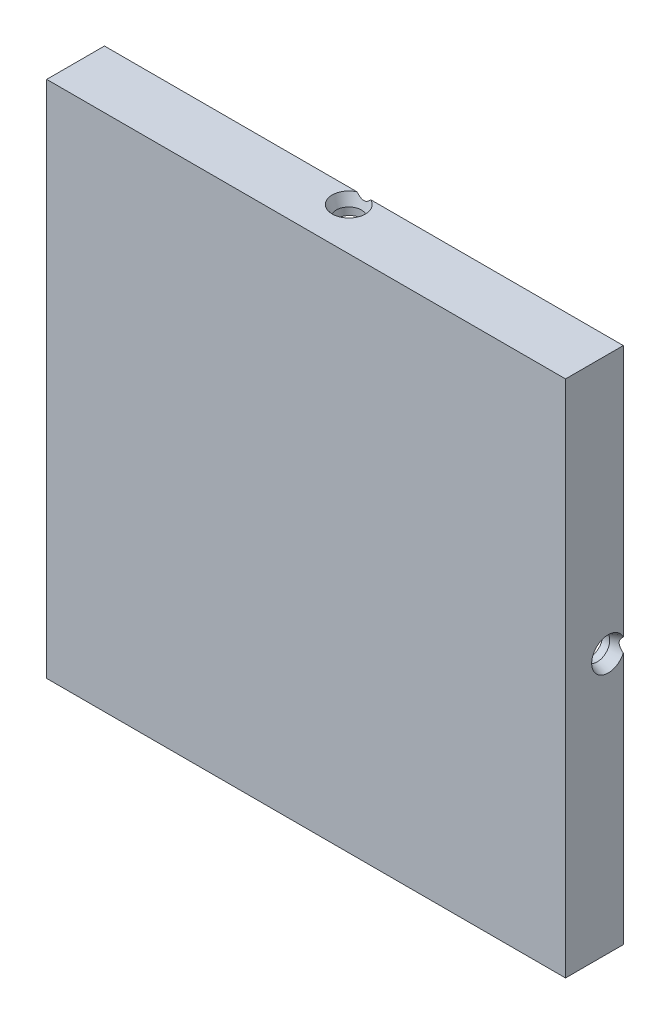
from build123d import *

# Parameters (mm, degrees)
SKETCH1_W               = 163.957
SKETCH1_H               = 163.957
SKETCH1_R               = 3.048
BOSS_EXTRUDE1_DEPTH     = 8.73125
BOSS_EXTRUDE2_START     = -9.525
SKETCH1_3_W             = 163.957
SKETCH1_3_H             = 163.957
SKETCH1_3_R             = 3.33375
SKETCH1_3_R_2           = 76.2
SKETCH1_3_R_3           = 3.01625
SKETCH1_3_R_4           = 3.048
BOSS_EXTRUDE2_DEPTH     = 9.525
SKETCH1_4_R             = 3.01625
BOSS_EXTRUDE3_DEPTH     = 18.3515
CUT_EXTRUDE1_REACH      = 186.226
CUT_EXTRUDE1_END_RADIUS = 76.2
SKETCH2_R               = 3.96875
CIRPATTERN1_COUNT       = 4
SKETCH5_R               = 3.047999999
BOSS_EXTRUDE4_DEPTH     = 9.525
CHAMFER1_SIZE           = 1.27
CHAMFER1_SIZE_2         = 3.489296323
BOSS_EXTRUDE5_DEPTH     = 18.25625
FILLET4_R               = 2.54


with BuildPart() as part:
    # Sketch1 → Boss-Extrude1 (new body)
    with BuildSketch(Plane.XY):
        Rectangle(SKETCH1_W, SKETCH1_H)
        with Locations((-26.851716639, -9.773225596)):
            Circle(SKETCH1_R, mode=Mode.SUBTRACT)
    extrude(amount=BOSS_EXTRUDE1_DEPTH)

    # Sketch1<3> → Boss-Extrude2 (add)
    # profile 1 of 6: a face of its own
    with BuildSketch(Plane.XY.offset(BOSS_EXTRUDE2_START)):
        Rectangle(SKETCH1_3_W, SKETCH1_3_H)
        with Locations((-69.2785, -69.2785)):
            Circle(SKETCH1_3_R, mode=Mode.SUBTRACT)
        with Locations((69.2785, -69.2785)):
            Circle(SKETCH1_3_R, mode=Mode.SUBTRACT)
        with Locations((69.2785, 69.2785)):
            Circle(SKETCH1_3_R, mode=Mode.SUBTRACT)
        with Locations((-69.2785, 69.2785)):
            Circle(SKETCH1_3_R, mode=Mode.SUBTRACT)
        Circle(SKETCH1_3_R_2, mode=Mode.SUBTRACT)
    # profile 2 of 6: a face of its own
    with BuildSketch(Plane.XY.offset(BOSS_EXTRUDE2_START)):
        with Locations((53.703433278, 19.546451191)):
            Circle(SKETCH1_3_R_3)
    # profile 3 of 6: a face of its own
    with BuildSketch(Plane.XY.offset(BOSS_EXTRUDE2_START)):
        with Locations((-9.923993354, -56.281763085)):
            Circle(SKETCH1_3_R_3)
    # profile 4 of 6: a face of its own
    with BuildSketch(Plane.XY.offset(BOSS_EXTRUDE2_START)):
        Circle(SKETCH1_3_R_3)
    # profile 5 of 6: a face of its own
    with BuildSketch(Plane.XY.offset(BOSS_EXTRUDE2_START)):
        with Locations((-43.779439924, 36.735311894)):
            Circle(SKETCH1_3_R_3)
    # profile 6 of 6: a face of its own
    with BuildSketch(Plane.XY.offset(BOSS_EXTRUDE2_START)):
        with Locations((-26.851716639, -9.773225596)):
            Circle(SKETCH1_3_R_4)
    extrude(amount=BOSS_EXTRUDE2_DEPTH)


with BuildPart() as boss_extrude2_piece_1:
    # of the separate pieces the step leaves, piece 1, a body of its own (boss_extrude2_pieces)
    add(part.part.solids().sort_by_distance((-81.9785, 81.9785, 8.73125))[0])

    # Sketch1<4> → Boss-Extrude3 (add)
    with BuildSketch(Plane.XY):
        Circle(SKETCH1_4_R)
    extrude(amount=-BOSS_EXTRUDE3_DEPTH)

    # Cut-Extrude1: up to this cylinder (the profile starts outside it)
    cut_extrude1_end = Plane(origin=(0, 0, -4.7625), z_dir=(0, 0, 1)) * Cylinder(CUT_EXTRUDE1_END_RADIUS, 525.852, mode=Mode.PRIVATE)
    # Sketch2 → Cut-Extrude1 (cut, up to the surface)
    with BuildSketch(Plane(origin=(0, 81.9785, 0), x_dir=(1, 0, 0), z_dir=(0, 1, 0)), mode=Mode.PRIVATE) as cut_extrude1_sk1:
        with Locations(Location((0, 4.7625, 0), (0, 0, 270))):
            Circle(SKETCH2_R)
    cut_extrude1_tool1 = extrude(cut_extrude1_sk1.sketch, amount=-CUT_EXTRUDE1_REACH, mode=Mode.PRIVATE) - cut_extrude1_end
    cut_extrude1 = cut_extrude1_tool1.solids().sort_by_distance((0, 81.9785, -4.7625))[0]
    add(cut_extrude1, mode=Mode.SUBTRACT)

    # CirPattern1: Cut-Extrude1 ×4 about axis
    cirpattern1_axis = Axis((0, 0, -9.525), (0, 0, 1))
    for i in range(1, CIRPATTERN1_COUNT):
        add(cut_extrude1.rotate(cirpattern1_axis, i * 360 / CIRPATTERN1_COUNT), mode=Mode.SUBTRACT)



with BuildPart() as boss_extrude2_piece_2:
    # of the separate pieces the step leaves, piece 2, a body of its own (boss_extrude2_pieces)
    add(part.part.solids().sort_by_distance((-23.803716639, -9.773225596, -9.525))[0])


with BuildPart() as boss_extrude2_piece_1_1:
    add(boss_extrude2_piece_1.part)

    add(boss_extrude2_piece_2.part)  # Boss-Extrude4 merges Boss-Extrude2 piece 2
    # Sketch5 → Boss-Extrude4 (add)
    with BuildSketch(Plane.XY.offset(8.73125)):
        with Locations((-26.851716639, -9.773225596)):
            Circle(SKETCH5_R)
    extrude(amount=-BOSS_EXTRUDE4_DEPTH)

    # Chamfer1
    # the kernel refuses this chamfer: 3.489296323, 1.27 mm, written as the material it takes off along each edge
    with BuildSketch(Plane(origin=(0, 81.9785, -4.7625), x_dir=(0, 0, 1), z_dir=(-1, 0, 0))) as chamfer1_piece_1:
        Polygon((3.96875 + CHAMFER1_SIZE, 0), (3.96875, -CHAMFER1_SIZE_2), (3.96875, 0), align=None)
    revolve(axis=Axis((0, 81.9785, -4.7625), (0, 1, 0)), mode=Mode.SUBTRACT)
    with BuildSketch(Plane(origin=(-81.9785, 0, -4.7625), x_dir=(0, 0, 1), z_dir=(0, -1, 0))) as chamfer1_piece_2:
        Polygon((3.96875 + CHAMFER1_SIZE, 0), (3.96875, -CHAMFER1_SIZE_2), (3.96875, 0), align=None)
    revolve(axis=Axis((-81.9785, 0, -4.7625), (-1, 0, 0)), mode=Mode.SUBTRACT)
    with BuildSketch(Plane(origin=(0, -81.9785, -4.7625), x_dir=(0, 0, 1), z_dir=(1, 0, 0))) as chamfer1_piece_3:
        Polygon((3.96875, -CHAMFER1_SIZE_2), (3.96875 + CHAMFER1_SIZE, 0), (3.96875, 0), align=None)
    revolve(axis=Axis((0, -81.9785, -4.7625), (0, -1, 0)), mode=Mode.SUBTRACT)
    with BuildSketch(Plane(origin=(81.9785, 0, -4.7625), x_dir=(0, 0, 1), z_dir=(0, 1, 0))) as chamfer1_piece_4:
        Polygon((3.96875 + CHAMFER1_SIZE, 0), (3.96875, -CHAMFER1_SIZE_2), (3.96875, 0), align=None)
    revolve(axis=Axis((81.9785, 0, -4.7625), (1, 0, 0)), mode=Mode.SUBTRACT)

    # Sketch6 → Boss-Extrude5 (add)
    with BuildSketch(Plane.XY.offset(8.73125)):
        with BuildLine():
            Line((7.480004995, 40.592806709), (6.854652072, 40.703073302))
            ThreePointArc((6.854652072, 40.703073302), (4.007726292, 40.071925052), (2.440934976, 37.61255532))
            Line((2.440934976, 37.61255532), (1.007469269, 29.482967319))
            ThreePointArc((1.007469269, 29.482967319), (1.638617519, 26.636041539), (4.097987251, 25.069250223))
            Line((4.097987251, 25.069250223), (4.723340174, 24.95898363))
            ThreePointArc((4.723340174, 24.95898363), (7.570265954, 25.59013188), (9.13705727, 28.049501612))
            Line((9.13705727, 28.049501612), (10.570522977, 36.179089613))
            ThreePointArc((10.570522977, 36.179089613), (9.939374727, 39.026015393), (7.480004995, 40.592806709))
        make_face()
    extrude(amount=-BOSS_EXTRUDE5_DEPTH)

    # Fillet4
    fillet4_edges = [boss_extrude2_piece_1_1.edges().sort_by_distance(p)[0] for p in [
        (9.939374727, 39.026015393, -9.525),
        (9.853790124, 32.114295613, -9.525),
        (7.570265954, 25.59013188, -9.525),
        (4.410663713, 25.014116927, -9.525),
        (1.638617519, 26.636041539, -9.525),
        (1.724202122, 33.547761319, -9.525),
        (4.007726292, 40.071925052, -9.525),
        (7.167328533, 40.647940006, -9.525),
    ]]
    fillet(fillet4_edges, radius=FILLET4_R)


solid = boss_extrude2_piece_1_1.part
